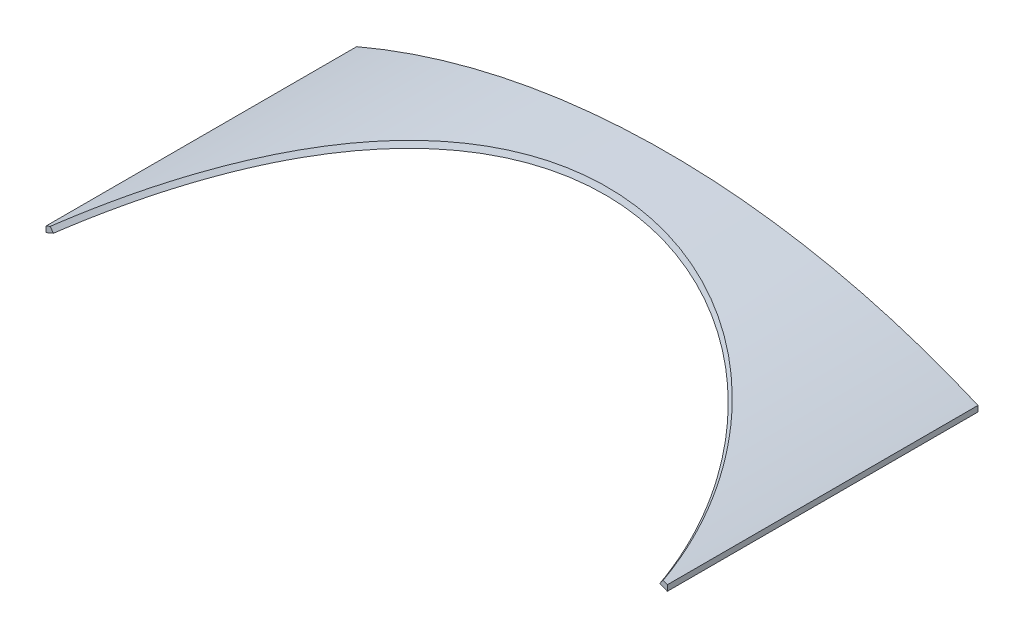
from build123d import *
from OCP.BRepAlgoAPI import BRepAlgoAPI_Cut
from OCP.TopTools import TopTools_ListOfShape

# Parameters (mm, degrees)
BOSS_EXTRU_1_DEPTH = 118


with BuildPart() as part:
    # Esquisse1 → Boss.-Extru.1 (new body)
    with BuildSketch(Plane.XY):
        with BuildLine():
            Line((-118.00000000000003, 275.8187810864227), (-118.00000000000003, 273.6421020237931))
            ThreePointArc((-118.00000000000003, 273.6421020237931), (1.825e-14, 297.99999999999994), (117.99999999999997, 273.6421020237931))
            Line((117.99999999999997, 273.6421020237931), (117.99999999999997, 275.8187810864227))
            ThreePointArc((117.99999999999997, 275.8187810864227), (1.837e-14, 299.99999999999994), (-118.00000000000003, 275.8187810864227))
        make_face()
    extrude(amount=BOSS_EXTRU_1_DEPTH)


with BuildPart() as enl_vement_de_mati_re_r_volution5_tool:
    # Enlèvement de matière-Révolution5: read off the stored shape, not the designer's step
    # Enlèvement de matière-Révolution5 outlin → Enlèvement de matière-Révolution5 (revolve)
    with BuildSketch(Plane.XZ.offset(-363)):
        with BuildLine():
            Line((63.000003013, 118.0000001), (63.000003013, 22.770266996))
            ThreePointArc((63.000003013, 22.770266996), (114.400520521, 61.442803893), (145.041373437, 118.0000001))
            Line((145.041373437, 118.0000001), (63.000003013, 118.0000001))
        make_face()
    revolve(axis=Axis((0, 363, 0), (0, 0, 1)))


with BuildPart() as part_1:
    add(part.part)

    # Enlèvement de matière-Révolution5: cut by enl_vement_de_mati_re_r_volution5_tool, with a tolerance
    enl_vement_de_mati_re_r_volution5_stock = TopTools_ListOfShape()
    enl_vement_de_mati_re_r_volution5_stock.Append(part_1.part.wrapped)
    enl_vement_de_mati_re_r_volution5_tools = TopTools_ListOfShape()
    enl_vement_de_mati_re_r_volution5_tools.Append(enl_vement_de_mati_re_r_volution5_tool.part.wrapped)
    enl_vement_de_mati_re_r_volution5_cut = BRepAlgoAPI_Cut()
    enl_vement_de_mati_re_r_volution5_cut.SetArguments(enl_vement_de_mati_re_r_volution5_stock)
    enl_vement_de_mati_re_r_volution5_cut.SetTools(enl_vement_de_mati_re_r_volution5_tools)
    enl_vement_de_mati_re_r_volution5_cut.SetFuzzyValue(0.00001)
    enl_vement_de_mati_re_r_volution5_cut.Build()
    add(Compound.cast(enl_vement_de_mati_re_r_volution5_cut.Shape()).solids(), mode=Mode.REPLACE)


solid = part_1.part
